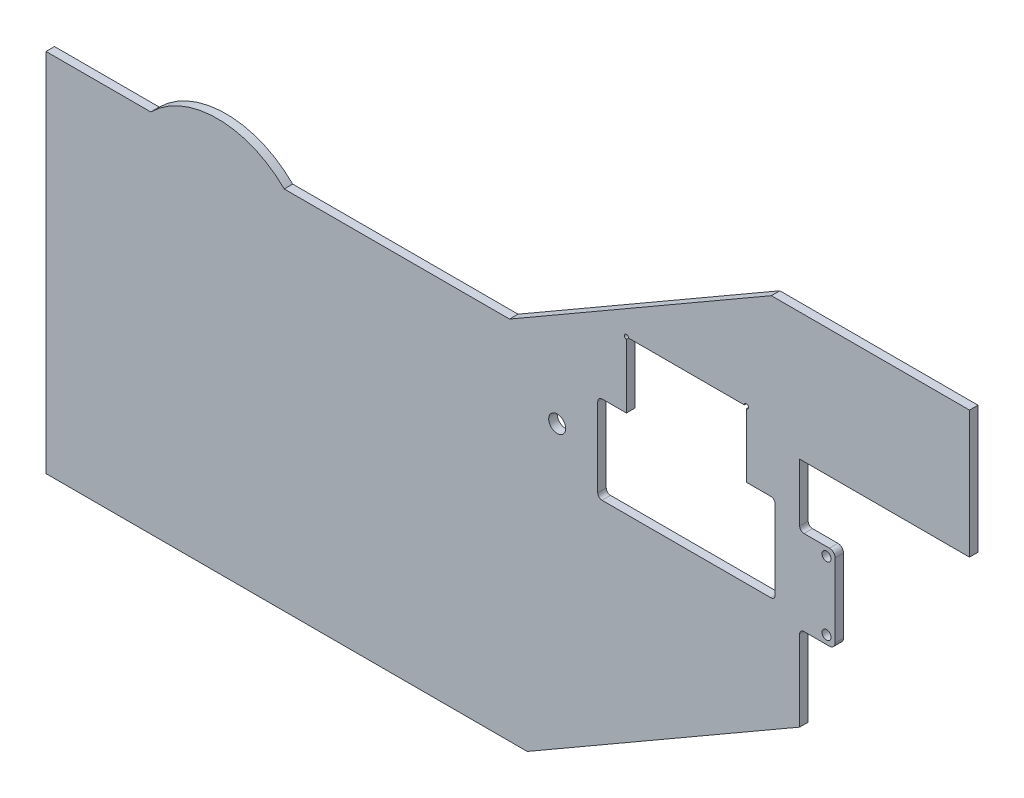
from build123d import *

# Parameters (mm, degrees)
SKETCH1_W           = 163.178820173
SKETCH1_H           = 83.61431582
BOSS_EXTRUDE1_DEPTH = 3
SKETCH2_R           = 3
CUT_EXTRUDE1_DEPTH  = 70
SKETCH3_R           = 1.6
BOSS_EXTRUDE2_DEPTH = 3
CUT_EXTRUDE2_DEPTH  = 10


with BuildPart() as part:
    # Sketch1 → Boss-Extrude1 (new body)
    with BuildSketch(Plane.XY):
        with Locations((-102.048100406, 5.79284209)):
            Rectangle(SKETCH1_W, SKETCH1_H)
    extrude(amount=BOSS_EXTRUDE1_DEPTH)

    # Sketch2 → Cut-Extrude1 (cut)
    with BuildSketch(Plane.XY.offset(3)):
        with Locations((-24.288671568, 24)):
            Circle(SKETCH2_R)
    extrude(amount=-CUT_EXTRUDE1_DEPTH, mode=Mode.SUBTRACT)

    # Sketch3 → Boss-Extrude2 (add)
    # profile 1 of 2: a face of its own
    with BuildSketch(Plane.XY.offset(3)):
        with BuildLine():
            Line((-20.45869032, -36.01431582), (-20.45869032, 47.6))
            Line((-20.45869032, 47.6), (-41.120184692, 47.6))
            Line((-41.120184692, 47.6), (51.371328432, 101))
            Line((51.371328432, 101), (121.371328432, 101))
            Line((121.371328432, 101), (121.371328432, 56))
            Line((121.371328432, 56), (61.371328432, 56))
            Line((61.371328432, 56), (61.371328432, 35.5))
            ThreePointArc((61.371328432, 35.5), (61.810668261, 34.439339828), (62.871328432, 34))
            Line((62.871328432, 34), (71.871328432, 34))
            ThreePointArc((71.871328432, 34), (73.285541995, 33.414213562), (73.871328432, 32))
            Line((73.871328432, 32), (73.871328432, 6))
            ThreePointArc((73.871328432, 6), (73.285541995, 4.585786438), (71.871328432, 4))
            Line((71.871328432, 4), (62.871328432, 4))
            ThreePointArc((62.871328432, 4), (61.810668261, 3.560660172), (61.371328432, 2.5))
            Line((61.371328432, 2.5), (61.371328432, -26))
            Line((61.371328432, -26), (-34.873017797, -81.566699204))
            Line((-34.873017797, -81.566699204), (-204.873017797, -81.566699204))
            Line((-204.873017797, -81.566699204), (-204.873017797, 47.6))
            Line((-204.873017797, 47.6), (-183.637510493, 47.6))
            Line((-183.637510493, 47.6), (-183.637510493, -36.01431582))
            Line((-183.637510493, -36.01431582), (-20.45869032, -36.01431582))
        make_face()
        with Locations((70.871328432, 31)):
            Circle(SKETCH3_R, mode=Mode.SUBTRACT)
        with Locations((70.871328432, 7)):
            Circle(SKETCH3_R, mode=Mode.SUBTRACT)
    # profile 2 of 2: a face of its own
    with BuildSketch(Plane.XY.offset(3)):
        with BuildLine():
            Line((-167.85268014, 47.6), (-120.724662995, 47.6))
            ThreePointArc((-120.724662995, 47.6), (-144.288671568, 57.35), (-167.85268014, 47.6))
        make_face()
    extrude(amount=-BOSS_EXTRUDE2_DEPTH)

    # Sketch4 → Cut-Extrude2 (cut)
    with BuildSketch(Plane.XY.offset(3)):
        with BuildLine():
            Line((0.171328432, 62.05), (0.171328432, 39.5))
            Line((0.171328432, 39.5), (-8.45869032, 39.5))
            ThreePointArc((-8.45869032, 39.5), (-9.519350491, 39.060660172), (-9.95869032, 38))
            Line((-9.95869032, 38), (-9.95869032, 10))
            ThreePointArc((-9.95869032, 10), (-9.519350491, 8.939339828), (-8.45869032, 8.5))
            Line((-8.45869032, 8.5), (51.201347185, 8.5))
            ThreePointArc((51.201347185, 8.5), (52.262007356, 8.939339828), (52.701347185, 10))
            Line((52.701347185, 10), (52.701347185, 38))
            ThreePointArc((52.701347185, 38), (52.262007356, 39.060660172), (51.201347185, 39.5))
            Line((51.201347185, 39.5), (42.571328432, 39.5))
            Line((42.571328432, 39.5), (42.571328432, 62.05))
            ThreePointArc((42.571328432, 62.05), (43.101658518, 63.330330086), (41.821328432, 62.8))
            Line((41.821328432, 62.8), (0.921328432, 62.8))
            ThreePointArc((0.921328432, 62.8), (-0.359001653, 63.330330086), (0.171328432, 62.05))
        make_face()
    extrude(amount=-CUT_EXTRUDE2_DEPTH, mode=Mode.SUBTRACT)


solid = part.part
